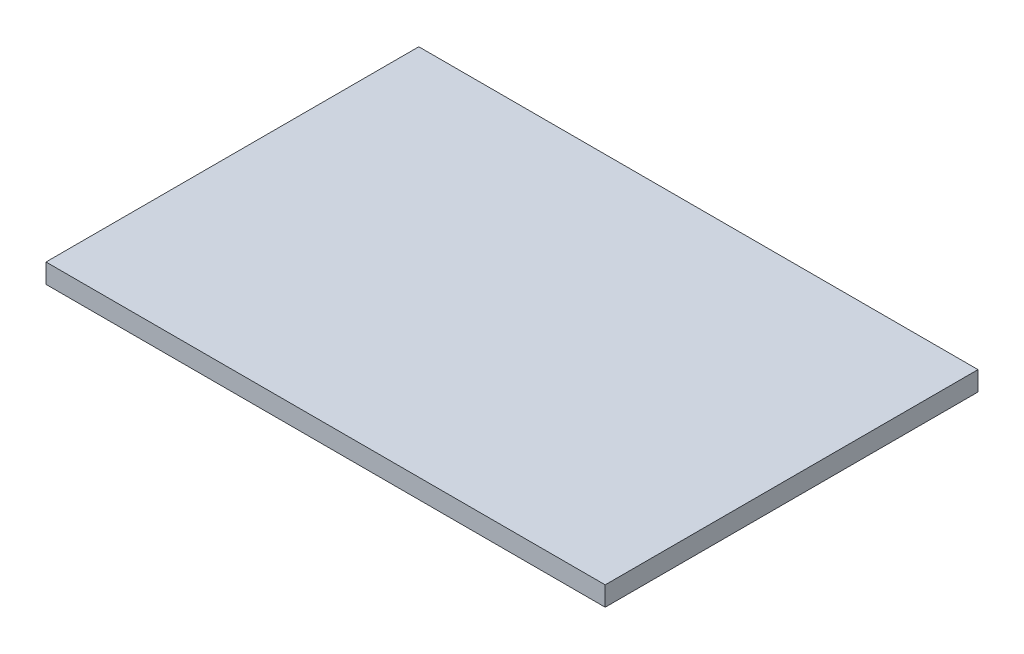
from build123d import *

# Parameters (mm, degrees)
SKETCH1_W           = 914.4
SKETCH1_H           = 609.6
BOSS_EXTRUDE1_DEPTH = 31.75


with BuildPart() as part:
    # Sketch1 → Boss-Extrude1 (new body)
    with BuildSketch(Plane(origin=(0, 0, 0), x_dir=(1, 0, 0), z_dir=(0, 1, 0))):
        Rectangle(SKETCH1_W, SKETCH1_H)
    extrude(amount=BOSS_EXTRUDE1_DEPTH)


solid = part.part
